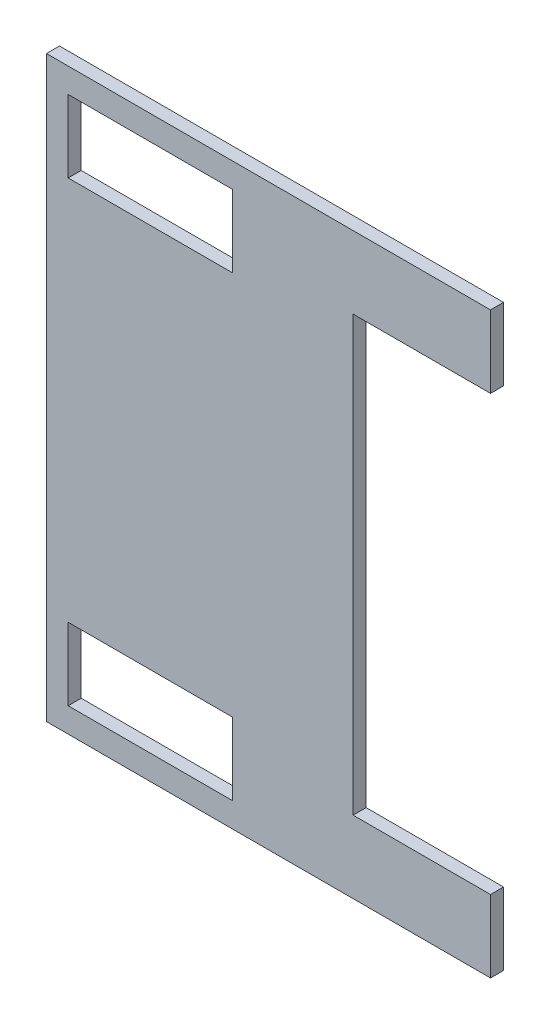
from build123d import *

# Parameters (mm, degrees)
SKETCH1_W           = 306.999208532
SKETCH1_H           = 400
SKETCH1_W_2         = 113.639208532
SKETCH1_H_2         = 50
BOSS_EXTRUDE1_DEPTH = 9
SKETCH2_W           = 95
SKETCH2_H           = 300
CUT_EXTRUDE1_DEPTH  = 460.151907085


with BuildPart() as part:
    # Sketch1 → Boss-Extrude1 (new body)
    with BuildSketch(Plane.XY):
        with Locations((-170.312553906, 125.4)):
            Rectangle(SKETCH1_W, SKETCH1_H)
        with Locations((-251.992553906, 283.4)):
            Rectangle(SKETCH1_W_2, SKETCH1_H_2, mode=Mode.SUBTRACT)
        with Locations((-251.992553906, -32.6)):
            Rectangle(SKETCH1_W_2, SKETCH1_H_2, mode=Mode.SUBTRACT)
    extrude(amount=BOSS_EXTRUDE1_DEPTH)

    # Sketch2 → Cut-Extrude1 (cut, through all)
    with BuildSketch(Plane(origin=(0, 0, 0), x_dir=(-1, 0, 0), z_dir=(0, 0, -1))):
        with Locations((64.31294964, 125.4)):
            Rectangle(SKETCH2_W, SKETCH2_H)
    extrude(amount=-CUT_EXTRUDE1_DEPTH, mode=Mode.SUBTRACT)


solid = part.part
